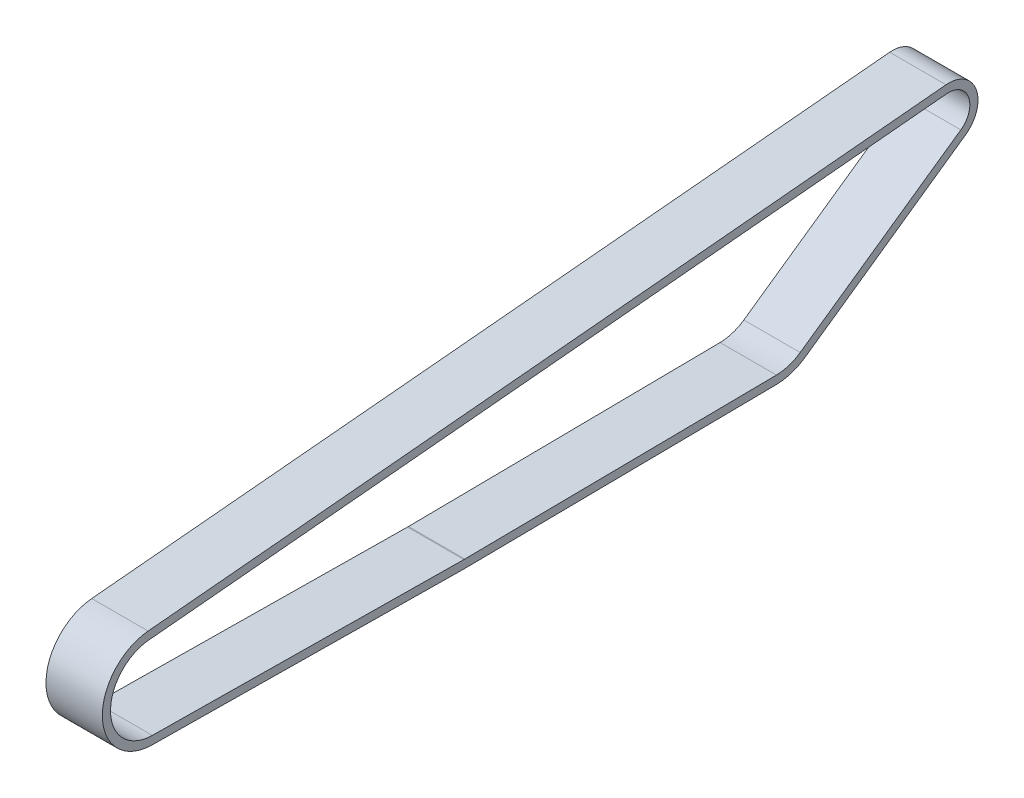
from build123d import *

# Parameters (mm, degrees)
EXTRUDE_THIN1_DEPTH     = 50.8
BODY_MOVE_COPY1_DEPTH   = 50.8
BODY_MOVE_COPY1_2_DEPTH = 50.8


# Read off the part's stored shape, not the designer's step: Body-Move/Copy1
with BuildPart() as part:
    # Sketch1 → Extrude-Thin1 (new body)
    with BuildSketch(Plane(origin=(0, 0, 0), x_dir=(0, 0, -1), z_dir=(1, 0, 0))):
        with BuildLine():
            Line((21.494042733, 166.084405055), (740.806573551, 99.245982925))
            ThreePointArc((740.806573551, 99.245982925), (782.028393343, 52.126153258), (737.113874036, 8.511904093))
            Line((737.113874036, 8.511904093), (456.21754645, 5.336904093))
            ThreePointArc((456.21754645, 5.336904093), (455.703672415, 5.334), (455.189798379, 5.336904093))
            Line((455.189798379, 5.336904093), (174.293470793, 8.511904093))
            ThreePointArc((174.293470793, 8.511904093), (160.890624168, 10.691261229), (148.729118574, 16.731433154))
            Line((148.729118574, 16.731433154), (3.898404857, 118.142990663))
            ThreePointArc((3.898404857, 118.142990663), (-5.748493412, 148.883347208), (21.494042733, 166.084405055))
        make_face()
        with BuildLine():
            Line((20.812530817, 158.75), (740.125061635, 91.91157787))
            ThreePointArc((740.125061635, 91.91157787), (774.668486042, 52.425687087), (737.0306207, 15.877433597))
            Line((737.0306207, 15.877433597), (456.134293115, 12.702433597))
            ThreePointArc((456.134293115, 12.702433597), (455.703672415, 12.7), (455.273051714, 12.702433597))
            Line((455.273051714, 12.702433597), (174.376724129, 15.877433597))
            ThreePointArc((174.376724129, 15.877433597), (163.145288409, 17.703710527), (152.954082604, 22.765307113))
            Line((152.954082604, 22.765307113), (8.123368888, 124.176864621))
            ThreePointArc((8.123368888, 124.176864621), (1.166471097, 146.345390976), (20.812530817, 158.75))
        make_face(mode=Mode.SUBTRACT)
    extrude(amount=EXTRUDE_THIN1_DEPTH)

    # Body-Move/Copy1 outline → Body-Move/Copy1 (cut)
    with BuildSketch(Plane.YZ):
        with BuildLine():
            ThreePointArc((166.084405055, -21.494042733), (164.537643621, -9.833229454), (158.082054122, 0))
            ThreePointArc((158.082054122, 0), (155.175079711, -2.417399882), (151.952776868, -4.395046666))
            ThreePointArc((151.952776868, -4.395046666), (157.382799095, -11.762737128), (158.75, -20.812530817))
            Line((158.75, -20.812530817), (91.91157787, -740.125061635))
            ThreePointArc((91.91157787, -740.125061635), (52.425687087, -774.668486042), (15.877433597, -737.0306207))
            Line((15.877433597, -737.0306207), (12.702433597, -456.134293115))
            ThreePointArc((12.702433597, -456.134293115), (12.7, -455.703672414), (12.702433597, -455.273051714))
            Line((12.702433597, -455.273051714), (15.877433597, -174.376724129))
            ThreePointArc((15.877433597, -174.376724129), (17.703710527, -163.145288409), (22.765307113, -152.954082604))
            Line((22.765307113, -152.954082604), (124.176864621, -8.123368888))
            ThreePointArc((124.176864621, -8.123368888), (125.769201584, -6.144494274), (127.610645261, -4.395046667))
            ThreePointArc((127.610645261, -4.395046667), (124.388342418, -2.417399882), (121.481368008, 0))
            ThreePointArc((121.481368008, 0), (119.717275174, -1.867931777), (118.142990663, -3.898404857))
            Line((118.142990663, -3.898404857), (16.731433154, -148.729118574))
            ThreePointArc((16.731433154, -148.729118574), (10.691261229, -160.890624168), (8.511904093, -174.293470793))
            Line((8.511904093, -174.293470793), (5.336904093, -455.189798379))
            ThreePointArc((5.336904093, -455.189798379), (5.334, -455.703672415), (5.336904093, -456.21754645))
            Line((5.336904093, -456.21754645), (8.511904093, -737.113874036))
            ThreePointArc((8.511904093, -737.113874036), (52.126153258, -782.028393343), (99.245982925, -740.806573551))
            Line((99.245982925, -740.806573551), (166.084405055, -21.494042733))
        make_face()
        with BuildLine():
            ThreePointArc((127.610645261, 4.395046667), (139.781711065, 0), (151.952776868, 4.395046666))
            ThreePointArc((151.952776868, 4.395046666), (139.781711065, 7.366), (127.610645261, 4.395046667))
        make_face()
    extrude(amount=BODY_MOVE_COPY1_DEPTH, mode=Mode.SUBTRACT)

    # Body-Move_Copy1 2 outline → Body-Move_Copy1 2 (add)
    with BuildSketch(Plane.YZ):
        with BuildLine():
            ThreePointArc((158.082054122, 0), (164.537643621, 9.833229454), (166.084405055, 21.494042733))
            Line((166.084405055, 21.494042733), (99.245982925, 740.806573551))
            ThreePointArc((99.245982925, 740.806573551), (52.126153258, 782.028393343), (8.511904093, 737.113874036))
            Line((8.511904093, 737.113874036), (5.336904093, 456.21754645))
            ThreePointArc((5.336904093, 456.21754645), (5.334, 455.703672415), (5.336904093, 455.189798379))
            Line((5.336904093, 455.189798379), (8.511904093, 174.293470793))
            ThreePointArc((8.511904093, 174.293470793), (10.691261229, 160.890624168), (16.731433154, 148.729118574))
            Line((16.731433154, 148.729118574), (118.142990663, 3.898404857))
            ThreePointArc((118.142990663, 3.898404857), (119.717275174, 1.867931777), (121.481368008, 0))
            ThreePointArc((121.481368008, 0), (124.388342418, 2.417399882), (127.610645261, 4.395046667))
            ThreePointArc((127.610645261, 4.395046667), (125.769201584, 6.144494274), (124.176864621, 8.123368888))
            Line((124.176864621, 8.123368888), (22.765307113, 152.954082604))
            ThreePointArc((22.765307113, 152.954082604), (17.703710527, 163.145288409), (15.877433597, 174.376724129))
            Line((15.877433597, 174.376724129), (12.702433597, 455.273051714))
            ThreePointArc((12.702433597, 455.273051714), (12.7, 455.703672415), (12.702433597, 456.134293115))
            Line((12.702433597, 456.134293115), (15.877433597, 737.0306207))
            ThreePointArc((15.877433597, 737.0306207), (52.425687087, 774.668486042), (91.91157787, 740.125061635))
            Line((91.91157787, 740.125061635), (158.75, 20.812530817))
            ThreePointArc((158.75, 20.812530817), (157.382799095, 11.762737128), (151.952776868, 4.395046666))
            ThreePointArc((151.952776868, 4.395046666), (155.175079711, 2.417399882), (158.082054122, 0))
        make_face()
        with BuildLine():
            ThreePointArc((127.610645261, -4.395046667), (139.781711065, -7.366), (151.952776868, -4.395046666))
            ThreePointArc((151.952776868, -4.395046666), (139.781711065, 0), (127.610645261, -4.395046667))
        make_face()
    extrude(amount=BODY_MOVE_COPY1_2_DEPTH)


solid = part.part
